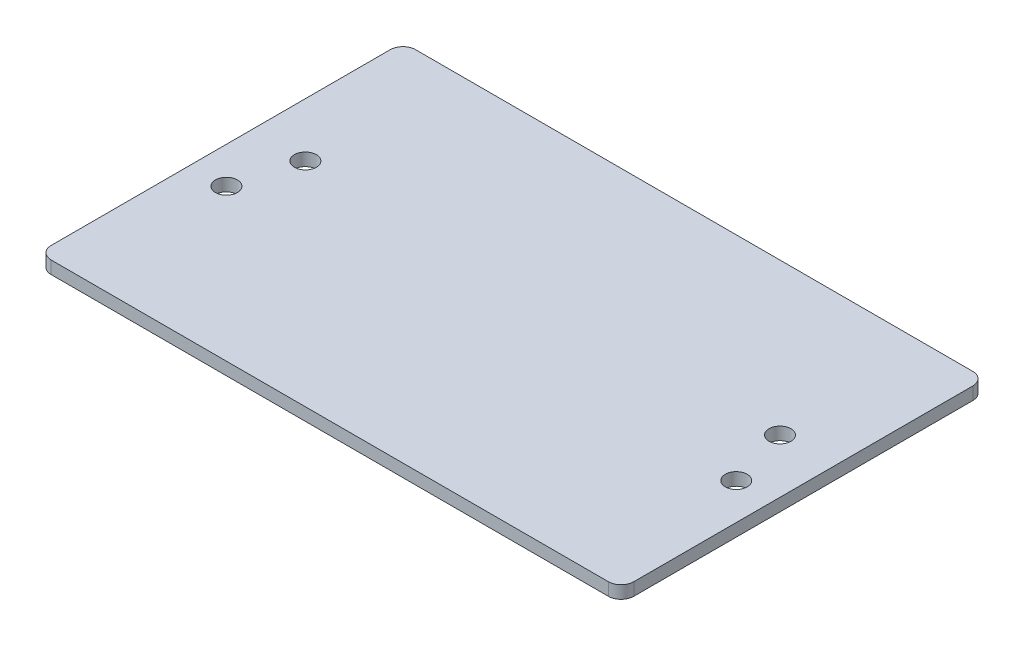
from build123d import *

# Parameters (mm, degrees)
SKETCH1_W           = 146.05
SKETCH1_H           = 91.35
SKETCH1_R           = 2.75
BOSS_EXTRUDE1_DEPTH = 3.175
FILLET1_R           = 3.175


with BuildPart() as part:
    # Sketch1 → Boss-Extrude1 (new body)
    with BuildSketch(Plane(origin=(0, 0, 0), x_dir=(1, 0, 0), z_dir=(0, 1, 0))):
        with Locations((73.025, 45.675)):
            Rectangle(SKETCH1_W, SKETCH1_H)
        with Locations((13.525, 53.3650935)):
            Circle(SKETCH1_R, mode=Mode.SUBTRACT)
        with Locations((9.114802, 37.9849065)):
            Circle(SKETCH1_R, mode=Mode.SUBTRACT)
        with Locations((132.525, 53.3650935)):
            Circle(SKETCH1_R, mode=Mode.SUBTRACT)
        with Locations((136.935198, 37.9849065)):
            Circle(SKETCH1_R, mode=Mode.SUBTRACT)
    extrude(amount=BOSS_EXTRUDE1_DEPTH)

    # Fillet1
    fillet1_edges = [part.edges().sort_by_distance(p)[0] for p in [
        (0, 1.5875, 0),
        (146.05, 1.5875, 0),
        (146.05, 1.5875, -91.35),
        (0, 1.5875, -91.35),
    ]]
    fillet(fillet1_edges, radius=FILLET1_R)


solid = part.part
